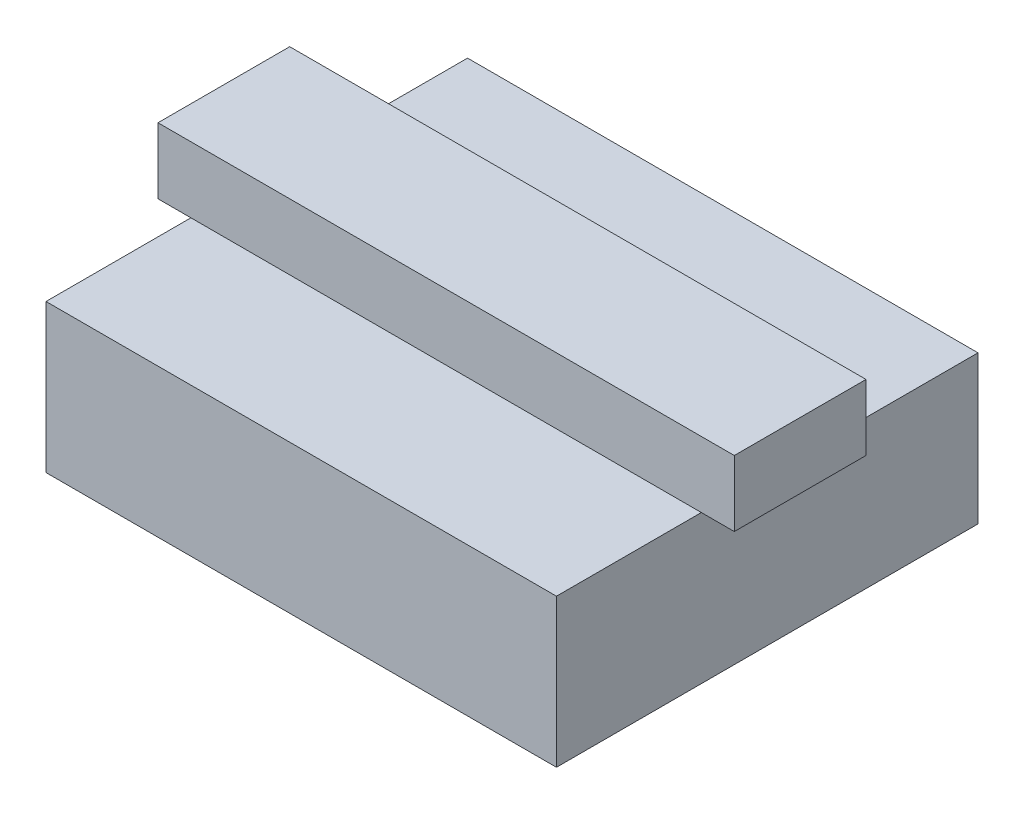
from build123d import *

# Parameters (mm, degrees)
SKETCH1_W           = 15.5
SKETCH1_H           = 12.8
BOSS_EXTRUDE1_DEPTH = 4.5
SKETCH2_R           = 1
BOSS_EXTRUDE2_DEPTH = 4
BOSS_EXTRUDE3_DEPTH = 2


with BuildPart() as part:
    # Sketch1 → Boss-Extrude1 (new body)
    with BuildSketch(Plane(origin=(0, 0, 0), x_dir=(1, 0, 0), z_dir=(0, 1, 0))):
        Rectangle(SKETCH1_W, SKETCH1_H)
    extrude(amount=BOSS_EXTRUDE1_DEPTH)

    # Sketch2 → Boss-Extrude2 (add)
    with BuildSketch(Plane.XZ):
        Circle(SKETCH2_R)
    extrude(amount=BOSS_EXTRUDE2_DEPTH)

    # Sketch3 → Boss-Extrude3 (add)
    with BuildSketch(Plane(origin=(0, 4.5, 0), x_dir=(1, 0, 0), z_dir=(0, 1, 0))):
        Polygon((-7.75, 2), (-8.75, 2), (-8.75, -2), (-7.75, -2), (7.75, -2), (8.75, -2), (8.75, 2), (7.75, 2), align=None)
    extrude(amount=BOSS_EXTRUDE3_DEPTH)


solid = part.part
